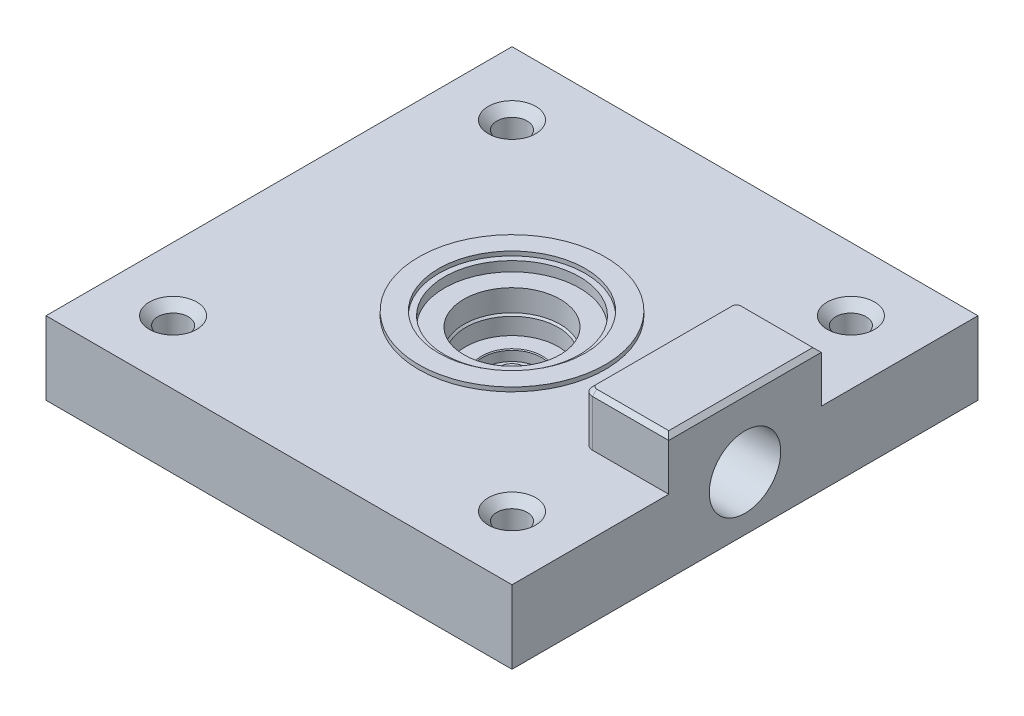
from build123d import *

# Parameters (mm, degrees)
SKETCH2_W               = 55
SKETCH2_H               = 55
SKETCH2_R               = 20
BOSS_EXTRUDE1_DEPTH     = 8.6446
CUT_EXTRUDE1_REACH      = 63.947
CUT_EXTRUDE1_END_RADIUS = 5.47
SKETCH3_R               = 1.5
CUT_EXTRUDE2_REACH      = 41.84
SKETCH4_R               = 1.8
CHAMFER1_SIZE           = 1
BOSS_EXTRUDE2_DEPTH     = 6
SKETCH8_R               = 4.2164
CUT_EXTRUDE5_DEPTH      = 7
CHAMFER2_SIZE           = 0.5
CHAMFER3_SIZE           = 0.75


# Read off the part's stored shape, not the designer's step: Revolve2
with BuildPart() as part:
    # Revolve2 outline → Revolve2 (revolve)
    with BuildSketch(Plane.XY):
        Polygon((20, -7.4946), (20, 1.15), (11.01, 1.15), (11.01, 1.65), (8.65, 1.65), (8.65, 1.15), (7.97, 1.15), (7.97, 0), (5.681592205, 0), (5.681592205, -2.5658216), (5.47, -2.777413805), (5.47, -4.75), (3.57599, -4.75), (3.47599, -4.85), (3.47599, -5.9946), (1.52019, -5.9946), (1.52019, -4.85), (1.42019, -4.75), (0.25, -4.75), (0.25, -7.4946), align=None)
    revolve(axis=Axis((0, 0, 0), (0, 1, 0)))

    # Sketch2 → Boss-Extrude1 (add)
    with BuildSketch(Plane(origin=(0, 1.15, 0), x_dir=(1, 0, 0), z_dir=(0, 1, 0))):
        Rectangle(SKETCH2_W, SKETCH2_H)
        Circle(SKETCH2_R, mode=Mode.SUBTRACT)
    extrude(amount=-BOSS_EXTRUDE1_DEPTH)

    # Cut-Extrude1: up to this cylinder (the profile starts outside it)
    cut_extrude1_end = Plane(origin=(0, -3.2946, 0), z_dir=(0, 1, 0)) * Cylinder(CUT_EXTRUDE1_END_RADIUS, 139.834, mode=Mode.PRIVATE)
    # Sketch3 → Cut-Extrude1 (cut, up to the surface)
    with BuildSketch(Plane(origin=(27.5, 0, 0), x_dir=(0, 0, -1), z_dir=(1, 0, 0)), mode=Mode.PRIVATE) as cut_extrude1_sk1:
        with Locations((0, -3.2946)):
            Circle(SKETCH3_R)
    cut_extrude1_tool1 = extrude(cut_extrude1_sk1.sketch, amount=-CUT_EXTRUDE1_REACH, mode=Mode.PRIVATE) - cut_extrude1_end
    add(cut_extrude1_tool1.solids().sort_by_distance((27.5, -3.2946, 0))[0], mode=Mode.SUBTRACT)

    # Sketch4 → Cut-Extrude2 (cut, up to next)
    with BuildSketch(Plane(origin=(0, 1.15, 0), x_dir=(1, 0, 0), z_dir=(0, 1, 0)), mode=Mode.PRIVATE) as cut_extrude2_sk1:
        with Locations(Location((20, 20, 0), (0, 0, 180))):
            Circle(SKETCH4_R)
    cut_extrude2_tool1 = extrude(cut_extrude2_sk1.sketch, amount=-CUT_EXTRUDE2_REACH, mode=Mode.PRIVATE) & part.part
    # Sketch4 → Cut-Extrude2 (cut, up to next)
    with BuildSketch(Plane(origin=(0, 1.15, 0), x_dir=(1, 0, 0), z_dir=(0, 1, 0)), mode=Mode.PRIVATE) as cut_extrude2_sk2:
        with Locations(Location((20, -20, 0), (0, 0, 180))):
            Circle(SKETCH4_R)
    cut_extrude2_tool2 = extrude(cut_extrude2_sk2.sketch, amount=-CUT_EXTRUDE2_REACH, mode=Mode.PRIVATE) & part.part
    # Sketch4 → Cut-Extrude2 (cut, up to next)
    with BuildSketch(Plane(origin=(0, 1.15, 0), x_dir=(1, 0, 0), z_dir=(0, 1, 0)), mode=Mode.PRIVATE) as cut_extrude2_sk3:
        with Locations(Location((-20, -20, 0), (0, 0, 180))):
            Circle(SKETCH4_R)
    cut_extrude2_tool3 = extrude(cut_extrude2_sk3.sketch, amount=-CUT_EXTRUDE2_REACH, mode=Mode.PRIVATE) & part.part
    # Sketch4 → Cut-Extrude2 (cut, up to next)
    with BuildSketch(Plane(origin=(0, 1.15, 0), x_dir=(1, 0, 0), z_dir=(0, 1, 0)), mode=Mode.PRIVATE) as cut_extrude2_sk4:
        with Locations(Location((-20, 20, 0), (0, 0, 180))):
            Circle(SKETCH4_R)
    cut_extrude2_tool4 = extrude(cut_extrude2_sk4.sketch, amount=-CUT_EXTRUDE2_REACH, mode=Mode.PRIVATE) & part.part
    add(cut_extrude2_tool1.solids().sort_by_distance((20, 1.15, -20))[0], mode=Mode.SUBTRACT)
    add(cut_extrude2_tool2.solids().sort_by_distance((20, 1.15, 20))[0], mode=Mode.SUBTRACT)
    add(cut_extrude2_tool3.solids().sort_by_distance((-20, 1.15, 20))[0], mode=Mode.SUBTRACT)
    add(cut_extrude2_tool4.solids().sort_by_distance((-20, 1.15, -20))[0], mode=Mode.SUBTRACT)

    # Chamfer1
    chamfer1_edges = [part.edges().sort_by_distance(p)[0] for p in [
        (-18.2, 1.15, -20),
        (-18.2, 1.15, 20),
        (21.8, 1.15, 20),
        (21.8, 1.15, -20),
    ]]
    chamfer(chamfer1_edges, length=CHAMFER1_SIZE)

    # Sketch9 → Boss-Extrude2 (add)
    with BuildSketch(Plane(origin=(0, 1.15, 0), x_dir=(1, 0, 0), z_dir=(0, 1, 0))):
        with BuildLine():
            Line((18.5, 9), (27.5, 9))
            Line((27.5, 9), (27.5, -9))
            Line((27.5, -9), (18.5, -9))
            ThreePointArc((18.5, -9), (17.792893219, -8.707106781), (17.5, -8))
            Line((17.5, -8), (17.5, 8))
            ThreePointArc((17.5, 8), (17.792893219, 8.707106781), (18.5, 9))
        make_face()
    extrude(amount=BOSS_EXTRUDE2_DEPTH)

    # Sketch8 → Cut-Extrude5 (cut)
    with BuildSketch(Plane(origin=(27.5, 0, 0), x_dir=(0, 0, -1), z_dir=(1, 0, 0))):
        with Locations((0, -1.0782)):
            Circle(SKETCH8_R)
    extrude(amount=-CUT_EXTRUDE5_DEPTH, mode=Mode.SUBTRACT)

    # Chamfer2
    chamfer2_edges = [part.edges().sort_by_distance(p)[0] for p in [
        (27.5, 7.15, 0),
        (23, 7.15, -9),
        (17.792893219, 7.15, -8.707106781),
        (17.5, 7.15, 0),
        (17.792893219, 7.15, 8.707106781),
        (23, 7.15, 9),
    ]]
    chamfer(chamfer2_edges, length=CHAMFER2_SIZE)

    # Chamfer3
    chamfer3_edges = [part.edges().sort_by_distance(p)[0] for p in [
        (-0.25, -4.75, 0),
    ]]
    chamfer(chamfer3_edges, length=CHAMFER3_SIZE)


solid = part.part
